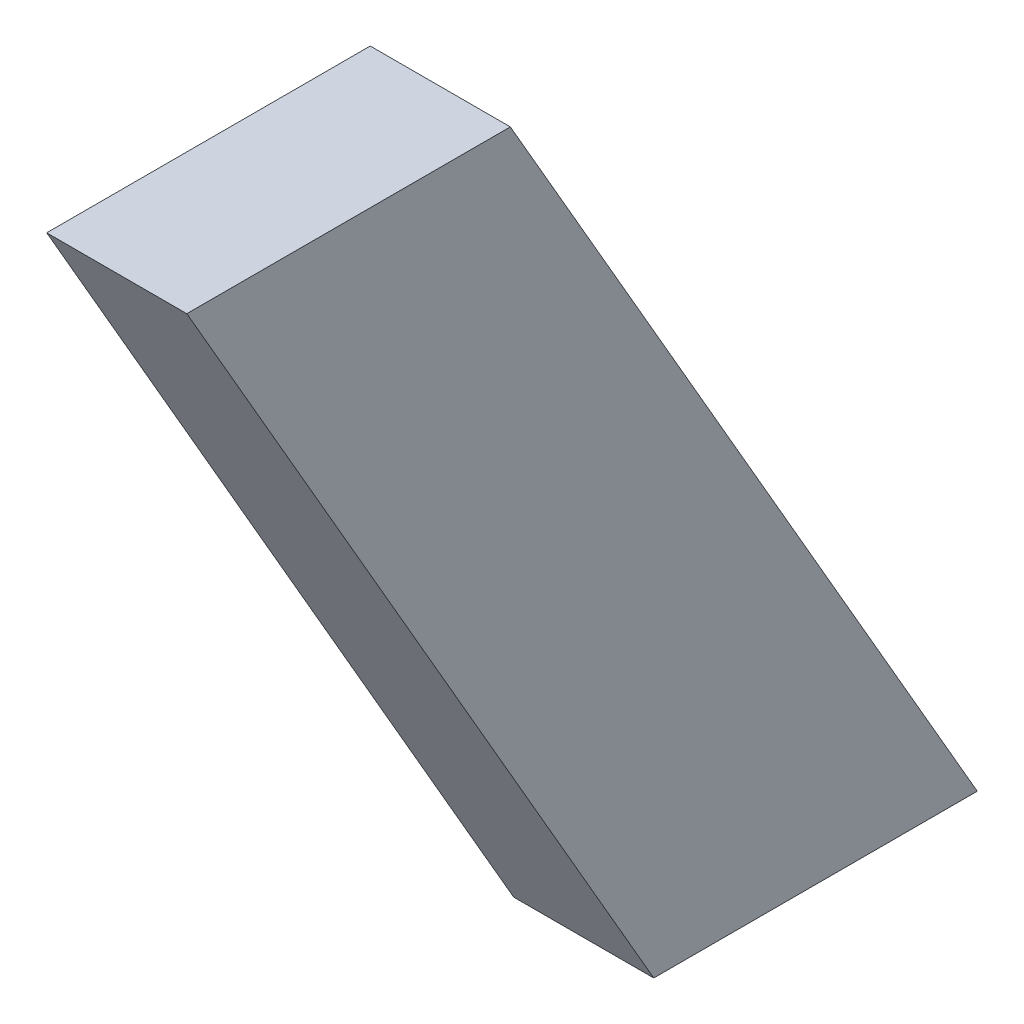
from build123d import *

# Parameters (mm, degrees)
BOSS_EXTRUDE1_DEPTH = 19.05


with BuildPart() as part:
    # Sketch2 → Boss-Extrude1 (new body)
    with BuildSketch(Plane(origin=(0, 0, 0), x_dir=(0, 0, -1), z_dir=(1, 0, 0))):
        Polygon((0, 0), (43.994090512, 0), (107.494090512, -109.985226281), (63.5, -109.985226281), align=None)
    extrude(amount=BOSS_EXTRUDE1_DEPTH)


solid = part.part
